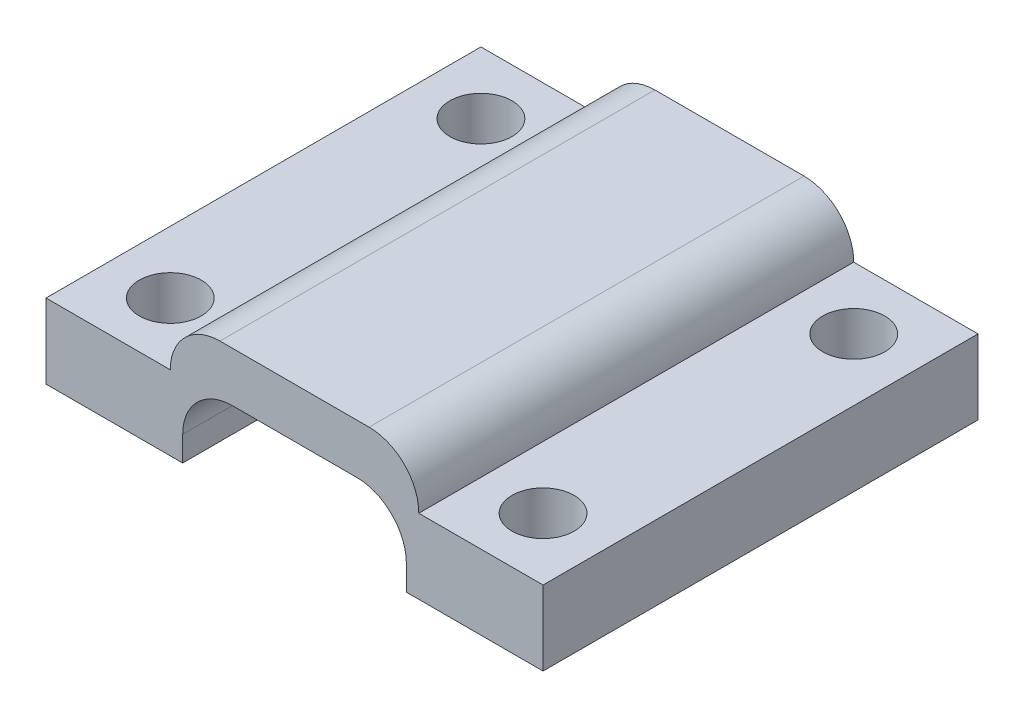
from build123d import *

# Parameters (mm, degrees)
SKETCH1_W           = 40
SKETCH1_H           = 35
BOSS_EXTRUDE1_DEPTH = 6
SKETCH2_R           = 2.5
CUT_EXTRUDE1_DEPTH  = 6
SKETCH3_W           = 20
SKETCH3_H           = 35
BOSS_EXTRUDE2_DEPTH = 4
SKETCH4_W           = 18
SKETCH4_H           = 35
CUT_EXTRUDE2_DEPTH  = 6
FILLET2_R           = 4
FILLET3_R           = 4


with BuildPart() as part:
    # Sketch1 → Boss-Extrude1 (new body)
    with BuildSketch(Plane(origin=(0, 0, 0), x_dir=(1, 0, 0), z_dir=(0, 1, 0))):
        with Locations((7.786458333, -9.114583333)):
            Rectangle(SKETCH1_W, SKETCH1_H)
    extrude(amount=BOSS_EXTRUDE1_DEPTH)

    # Sketch2 → Cut-Extrude1 (cut)
    with BuildSketch(Plane(origin=(0, 6, 0), x_dir=(1, 0, 0), z_dir=(0, 1, 0))):
        with Locations(Location((-7.213541667, -21.614583333, 0), (0, 0, 270))):
            Circle(SKETCH2_R)
        with Locations(Location((22.786458333, 3.385416667, 0), (0, 0, 270))):
            Circle(SKETCH2_R)
        with Locations(Location((22.786458333, -21.614583333, 0), (0, 0, 270))):
            Circle(SKETCH2_R)
        with Locations(Location((-7.213541667, 3.385416667, 0), (0, 0, 270))):
            Circle(SKETCH2_R)
    extrude(amount=-CUT_EXTRUDE1_DEPTH, mode=Mode.SUBTRACT)

    # Sketch3 → Boss-Extrude2 (add)
    with BuildSketch(Plane(origin=(0, 6, 0), x_dir=(1, 0, 0), z_dir=(0, 1, 0))):
        with Locations((7.786458333, -9.114583333)):
            Rectangle(SKETCH3_W, SKETCH3_H)
    extrude(amount=BOSS_EXTRUDE2_DEPTH)

    # Sketch4 → Cut-Extrude2 (cut)
    with BuildSketch(Plane.XZ):
        with Locations((7.786458333, 9.114583333)):
            Rectangle(SKETCH4_W, SKETCH4_H)
    extrude(amount=-CUT_EXTRUDE2_DEPTH, mode=Mode.SUBTRACT)

    # Fillet2
    fillet2_edges = [part.edges().sort_by_distance(p)[0] for p in [
        (-1.213541667, 6, 9.114583333),
        (16.786458333, 6, 9.114583333),
    ]]
    fillet(fillet2_edges, radius=FILLET2_R)

    # Fillet3
    fillet3_edges = [part.edges().sort_by_distance(p)[0] for p in [
        (17.786458333, 10, 9.114583333),
        (-2.213541667, 10, 9.114583333),
    ]]
    fillet(fillet3_edges, radius=FILLET3_R - 0.0001)  # a hair under: the kernel refuses the full size


solid = part.part
